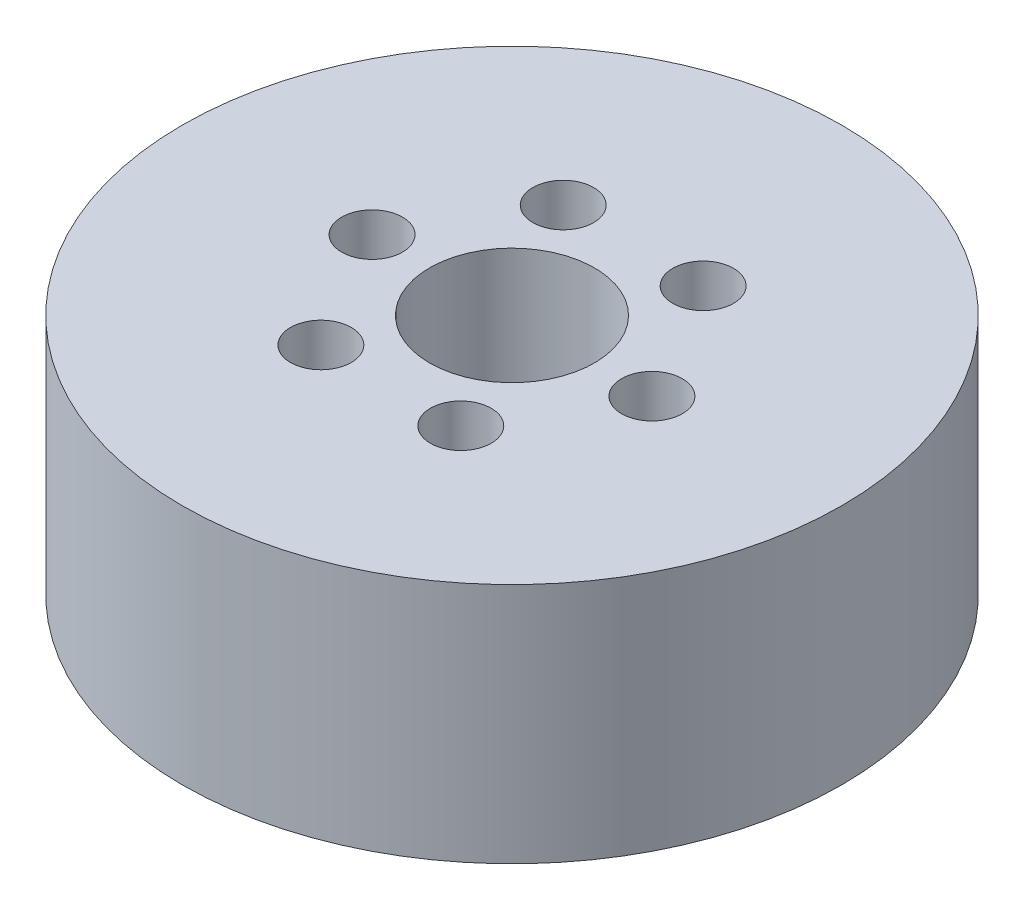
from build123d import *

# Parameters (mm, degrees)
SKETCH1_R           = 30
BOSS_EXTRUDE1_DEPTH = 22
SKETCH2_R           = 7.5
CUT_EXTRUDE1_DEPTH  = 48.791212581
SKETCH3_R           = 2.765696192
CUT_EXTRUDE2_DEPTH  = 21.783794888
CIRPATTERN1_COUNT   = 6


with BuildPart() as part:
    # Sketch1 → Boss-Extrude1 (new body)
    with BuildSketch(Plane(origin=(0, 0, 0), x_dir=(1, 0, 0), z_dir=(0, 1, 0))):
        Circle(SKETCH1_R)
    extrude(amount=BOSS_EXTRUDE1_DEPTH)

    # Sketch2 → Cut-Extrude1 (cut, through all)
    with BuildSketch(Plane(origin=(0, 0, 0), x_dir=(1, 0, 0), z_dir=(0, 1, 0))):
        Circle(SKETCH2_R)
    extrude(amount=CUT_EXTRUDE1_DEPTH, mode=Mode.SUBTRACT)

    # Sketch3 → Cut-Extrude2 (cut)
    with BuildSketch(Plane(origin=(0, 22, 0), x_dir=(1, 0, 0), z_dir=(0, 1, 0))):
        with Locations((-12.731266819, 0)):
            Circle(SKETCH3_R)
    cut_extrude2 = extrude(amount=-CUT_EXTRUDE2_DEPTH, mode=Mode.SUBTRACT)

    # CirPattern1: Cut-Extrude2 ×6 about axis
    cirpattern1_axis = Axis((0, 0, 0), (0, 1, 0))
    for i in range(1, CIRPATTERN1_COUNT):
        add(cut_extrude2.rotate(cirpattern1_axis, i * 360 / CIRPATTERN1_COUNT), mode=Mode.SUBTRACT)


solid = part.part
